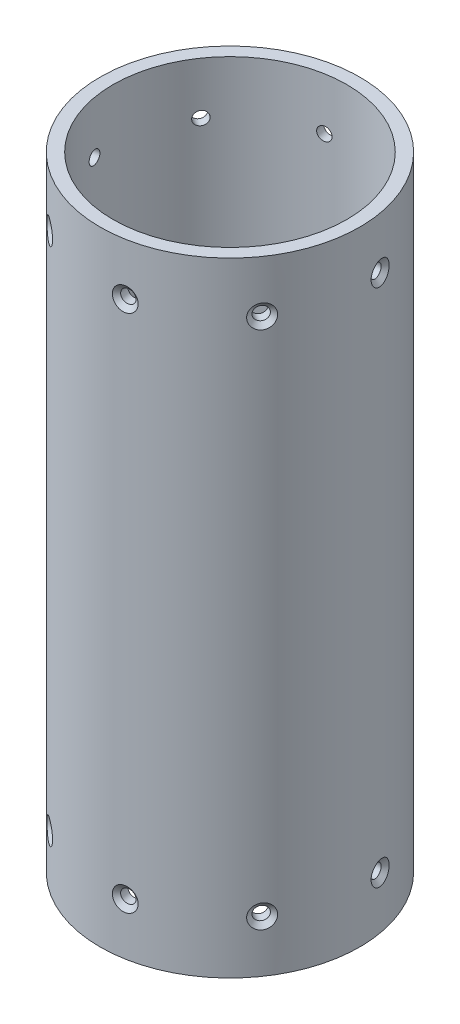
from build123d import *

# Parameters (mm, degrees)
SKETCH1_R           = 31.75
SKETCH1_R_2         = 28.575
BOSS_EXTRUDE1_DEPTH = 152.4
CIRPATTERN1_COUNT   = 8
LPATTERN1_COUNT     = 2
LPATTERN1_PITCH     = 127


# Read off the part's stored shape, not the designer's step: CSK for #4 Flat Head Machine Screw (100)1
with BuildPart() as part:
    # Sketch1 → Boss-Extrude1 (new body)
    with BuildSketch(Plane(origin=(0, 0, 0), x_dir=(1, 0, 0), z_dir=(0, 1, 0))):
        with Locations(Location((-3.288273087, -10.750573627, 0), (0, 0, 90))):
            Circle(SKETCH1_R)
        with Locations(Location((-3.288273087, -10.750573627, 0), (0, 0, 90))):
            Circle(SKETCH1_R_2, mode=Mode.SUBTRACT)
    extrude(amount=BOSS_EXTRUDE1_DEPTH)

    # CSK for _4 Flat Head Machine Screw _ 2 → CSK for #4 Flat Head Machine Screw (100)1 (revolve, cut)
    with BuildSketch(Plane(origin=(-6.11784036, 139.7, 8.778648014), x_dir=(0.5717542102782798, 0, -0.8204249648987167), z_dir=(0, -1, 0))):
        Polygon((2.857579377, 35.198971007), (0, 35.198971007), (0, 31.977602731), (1.6256, 31.977602731), (1.6256, 34.165217566), align=None)
    csk_for_4_flat_head_machine_screw_100 = revolve(axis=Axis((-6.11784036, 139.7, 8.778648014), (0.8204249648987167, 0, 0.5717542102782798)), mode=Mode.SUBTRACT)

    # CirPattern1: CSK for #4 Flat Head Machine Screw (100)1 ×8 about axis
    cirpattern1_axis = Axis((-3.288273087, 152.4, 10.750573627), (0, -1, 0))
    for i in range(1, CIRPATTERN1_COUNT):
        add(csk_for_4_flat_head_machine_screw_100.rotate(cirpattern1_axis, i * 360 / CIRPATTERN1_COUNT), mode=Mode.SUBTRACT)

    # LPattern1: CSK for #4 Flat Head Machine Screw (100)1 ×2
    with Locations(*[(0, -i * LPATTERN1_PITCH, 0) for i in range(1, LPATTERN1_COUNT)]):
        add(csk_for_4_flat_head_machine_screw_100, mode=Mode.SUBTRACT)

    # LPattern1 copy 1 sketch → LPattern1 copy 1 (revolve, cut)
    with BuildSketch(Plane(origin=(-3.894717321, 12.7, 7.355405447), x_dir=(0.9844193353943487, 0, -0.17583677687488702), z_dir=(0, -1, 0))):
        Polygon((2.857579377, 35.198971007), (0, 35.198971007), (0, 31.977602731), (1.6256, 31.977602731), (1.6256, 34.165217566), align=None)
    revolve(axis=Axis((-3.894717321, 12.7, 7.355405447), (0.17583677687488702, 0, 0.9844193353943487)), mode=Mode.SUBTRACT)

    # LPattern1 copy 2 sketch → LPattern1 copy 2 (revolve, cut)
    with BuildSketch(Plane(origin=(-1.316347474, 12.7, 7.921006354), x_dir=(0.8204249648987167, 0, 0.5717542102782798), z_dir=(0, -1, 0))):
        Polygon((2.857579377, 35.198971007), (0, 35.198971007), (0, 31.977602731), (1.6256, 31.977602731), (1.6256, 34.165217566), align=None)
    revolve(axis=Axis((-1.316347474, 12.7, 7.921006354), (-0.5717542102782798, 0, 0.8204249648987167)), mode=Mode.SUBTRACT)

    # LPattern1 copy 3 sketch → LPattern1 copy 3 (revolve, cut)
    with BuildSketch(Plane(origin=(0.106895092, 12.7, 10.144129393), x_dir=(0.17583677687488702, 0, 0.9844193353943487), z_dir=(0, -1, 0))):
        Polygon((2.857579377, 35.198971007), (0, 35.198971007), (0, 31.977602731), (1.6256, 31.977602731), (1.6256, 34.165217566), align=None)
    revolve(axis=Axis((0.106895092, 12.7, 10.144129393), (-0.9844193353943487, 0, 0.17583677687488702)), mode=Mode.SUBTRACT)

    # LPattern1 copy 4 sketch → LPattern1 copy 4 (revolve, cut)
    with BuildSketch(Plane(origin=(-0.458705814, 12.7, 12.722499239), x_dir=(-0.5717542102782797, 0, 0.8204249648987169), z_dir=(0, -1, 0))):
        Polygon((2.857579377, 35.198971007), (0, 35.198971007), (0, 31.977602731), (1.6256, 31.977602731), (1.6256, 34.165217566), align=None)
    revolve(axis=Axis((-0.458705814, 12.7, 12.722499239), (-0.8204249648987169, 0, -0.5717542102782797)), mode=Mode.SUBTRACT)

    # LPattern1 copy 5 sketch → LPattern1 copy 5 (revolve, cut)
    with BuildSketch(Plane(origin=(-2.681828853, 12.7, 14.145741806), x_dir=(-0.9844193353943488, 0, 0.17583677687488714), z_dir=(0, -1, 0))):
        Polygon((2.857579377, 35.198971007), (0, 35.198971007), (0, 31.977602731), (1.6256, 31.977602731), (1.6256, 34.165217566), align=None)
    revolve(axis=Axis((-2.681828853, 12.7, 14.145741806), (-0.17583677687488714, 0, -0.9844193353943488)), mode=Mode.SUBTRACT)

    # LPattern1 copy 6 sketch → LPattern1 copy 6 (revolve, cut)
    with BuildSketch(Plane(origin=(-5.2601987, 12.7, 13.5801409), x_dir=(-0.8204249648987169, 0, -0.5717542102782797), z_dir=(0, -1, 0))):
        Polygon((2.857579377, 35.198971007), (0, 35.198971007), (0, 31.977602731), (1.6256, 31.977602731), (1.6256, 34.165217566), align=None)
    revolve(axis=Axis((-5.2601987, 12.7, 13.5801409), (0.5717542102782797, 0, -0.8204249648987169)), mode=Mode.SUBTRACT)

    # LPattern1 copy 7 sketch → LPattern1 copy 7 (revolve, cut)
    with BuildSketch(Plane(origin=(-6.683441266, 12.7, 11.357017861), x_dir=(-0.1758367768748872, 0, -0.9844193353943487), z_dir=(0, -1, 0))):
        Polygon((2.857579377, 35.198971007), (0, 35.198971007), (0, 31.977602731), (1.6256, 31.977602731), (1.6256, 34.165217566), align=None)
    revolve(axis=Axis((-6.683441266, 12.7, 11.357017861), (0.9844193353943487, 0, -0.1758367768748872)), mode=Mode.SUBTRACT)


solid = part.part
